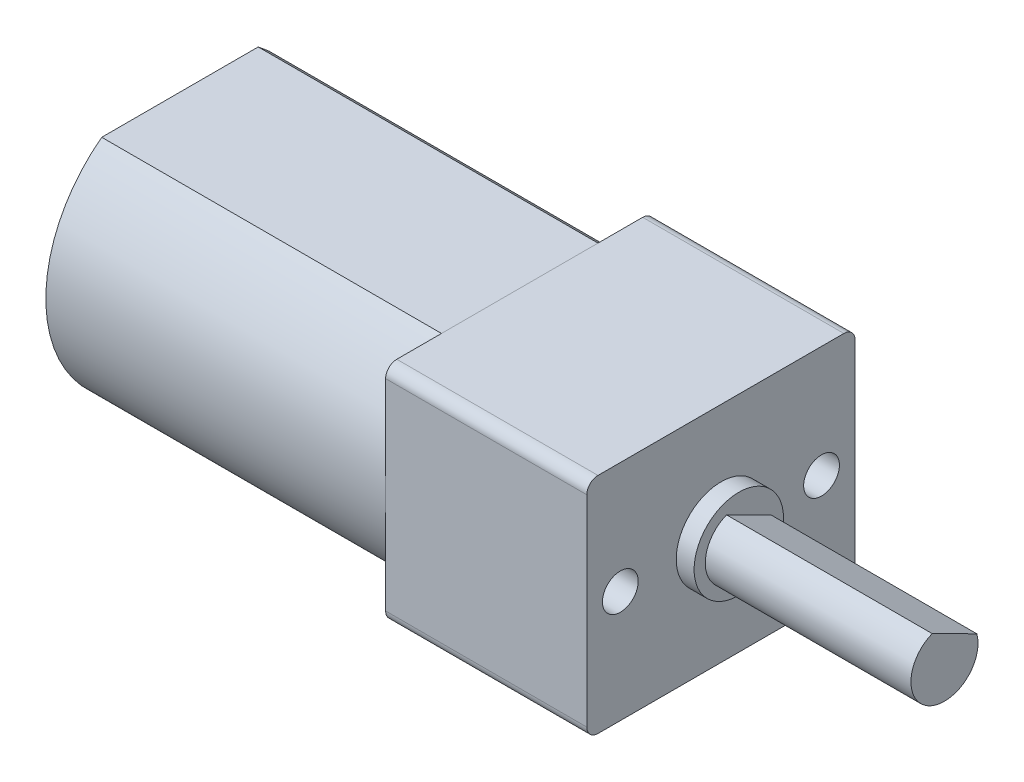
from build123d import *

# Parameters (mm, degrees)
BOSS_EXTRUDE3_DEPTH = 15.2
BOSS_EXTRUDE4_DEPTH = 9
SKETCH4_R           = 2
BOSS_EXTRUDE5_DEPTH = 0.8
BOSS_EXTRUDE6_DEPTH = 9.2
SKETCH6_R           = 0.8
CUT_EXTRUDE1_DEPTH  = 2


with BuildPart() as part:
    # Sketch1 → Boss-Extrude3 (new body)
    with BuildSketch(Plane(origin=(0, 0, 0), x_dir=(0, 0, -1), z_dir=(1, 0, 0))):
        with BuildLine():
            Line((3.5, 5), (-3.5, 5))
            ThreePointArc((-3.5, 5), (-6, 0), (-3.5, -5))
            Line((-3.5, -5), (3.5, -5))
            ThreePointArc((3.5, -5), (6, 0), (3.5, 5))
        make_face()
    extrude(amount=BOSS_EXTRUDE3_DEPTH)


with BuildPart() as body_2:
    # Sketch3 → Boss-Extrude4 (new body)
    with BuildSketch(Plane(origin=(15.2, 0, 0), x_dir=(0, 0, -1), z_dir=(1, 0, 0))):
        with BuildLine():
            Line((-5.5, 5), (5.5, 5))
            ThreePointArc((5.5, 5), (5.853553391, 4.853553391), (6, 4.5))
            Line((6, 4.5), (6, -4.5))
            ThreePointArc((6, -4.5), (5.853553391, -4.853553391), (5.5, -5))
            Line((5.5, -5), (-5.5, -5))
            ThreePointArc((-5.5, -5), (-5.853553391, -4.853553391), (-6, -4.5))
            Line((-6, -4.5), (-6, 4.5))
            ThreePointArc((-6, 4.5), (-5.853553391, 4.853553391), (-5.5, 5))
        make_face()
    extrude(amount=BOSS_EXTRUDE4_DEPTH)

    # Sketch4 → Boss-Extrude5 (add)
    with BuildSketch(Plane(origin=(24.2, 0, 0), x_dir=(0, 0, -1), z_dir=(1, 0, 0))):
        Circle(SKETCH4_R)
    extrude(amount=BOSS_EXTRUDE5_DEPTH)

    # Sketch6 → Cut-Extrude1 (cut)
    with BuildSketch(Plane(origin=(24.2, 0, 0), x_dir=(0, 0, -1), z_dir=(1, 0, 0))):
        with Locations((4.5, 0)):
            Circle(SKETCH6_R)
        with Locations((-4.5, 0)):
            Circle(SKETCH6_R)
    extrude(amount=-CUT_EXTRUDE1_DEPTH, mode=Mode.SUBTRACT)


with BuildPart() as body_3:
    # Sketch5 → Boss-Extrude6 (new body)
    with BuildSketch(Plane(origin=(25, 0, 0), x_dir=(0, 0, -1), z_dir=(1, 0, 0))):
        with BuildLine():
            Line((1.448199531, 0.390791656), (-0.54928293, 1.39581097))
            ThreePointArc((-0.54928293, 1.39581097), (-0.844415658, -1.239742795), (1.5, 0))
            ThreePointArc((1.5, 0), (1.486993493, 0.197104926), (1.448199531, 0.390791656))
        make_face()
    extrude(amount=BOSS_EXTRUDE6_DEPTH)


solid = Compound([part.part, body_2.part, body_3.part])
